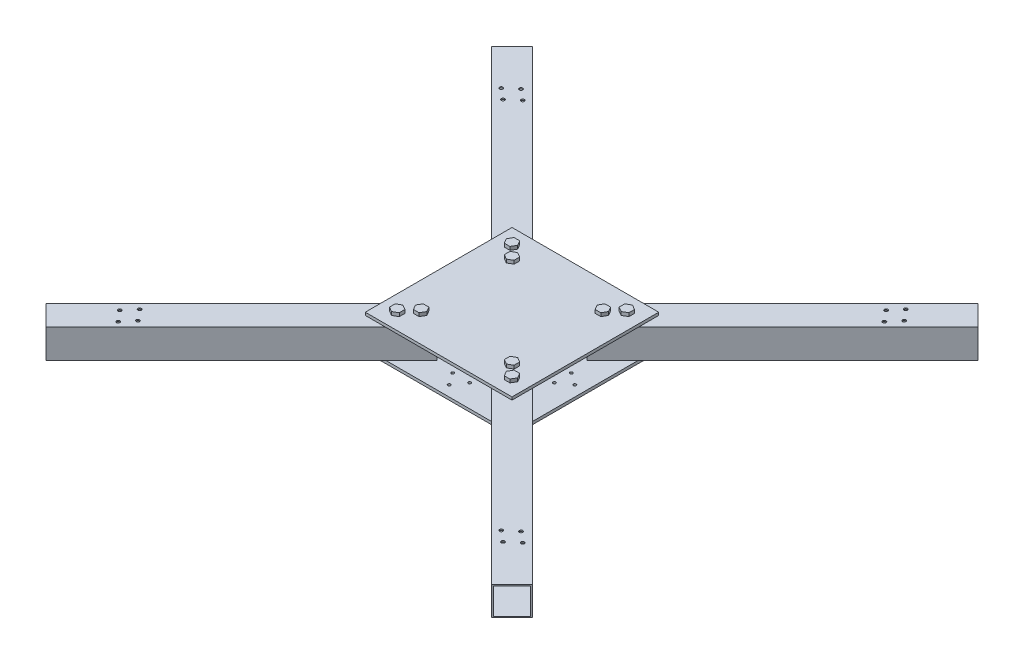
from build123d import *

# Parameters (mm, degrees)
SKETCH1_W             = 130
SKETCH1_H             = 130
BOSS_EXTRUDE1_DEPTH   = 2.5
BOSS_EXTRUDE2_START   = -45
SKETCH5_W             = 25.4
SKETCH5_H             = 25.4
SKETCH5_W_2           = 23.4
SKETCH5_H_2           = 23.4
BOSS_EXTRUDE2_DEPTH   = 245
CIRPATTERN1_COUNT     = 4
SKETCH8_W             = 130
SKETCH8_H             = 130
BOSS_EXTRUDE3_DEPTH   = 2.5
CUT_EXTRUDE1_DEPTH    = 307.137010525
CIRPATTERN2_COUNT     = 4
SKETCH11_R            = 2.5
BOSS_EXTRUDE4_DEPTH   = 38.1
BOSS_EXTRUDE4_2_DEPTH = 38.1
BOSS_EXTRUDE5_DEPTH   = 3
BOSS_EXTRUDE6_DEPTH   = 3
BOSS_EXTRUDE7_DEPTH   = 3
BOSS_EXTRUDE7_2_DEPTH = 3
CIRPATTERN5_COUNT     = 4
SKETCH16_R            = 1.5
CUT_EXTRUDE3_DEPTH    = 1
CIRPATTERN7_COUNT     = 4
SKETCH17_R            = 1.25
CUT_EXTRUDE4_DEPTH    = 2.5
CIRPATTERN8_COUNT     = 4


with BuildPart() as part:
    # Sketch1 → Boss-Extrude1 (new body)
    with BuildSketch(Plane(origin=(0, 0, 0), x_dir=(1, 0, 0), z_dir=(0, 1, 0))):
        Rectangle(SKETCH1_W, SKETCH1_H)
    extrude(amount=BOSS_EXTRUDE1_DEPTH)

    # Sketch5 → Boss-Extrude2 (add)
    with BuildSketch(Plane(origin=(65, 0, -65), x_dir=(-0.7071067811865475, 0, -0.7071067811865477), z_dir=(0.7071067811865477, 0, -0.7071067811865475)).offset(BOSS_EXTRUDE2_START)):
        with Locations((0, 15.2)):
            Rectangle(SKETCH5_W, SKETCH5_H)
        with Locations((0, 15.2)):
            Rectangle(SKETCH5_W_2, SKETCH5_H_2, mode=Mode.SUBTRACT)
    boss_extrude2 = extrude(amount=BOSS_EXTRUDE2_DEPTH)

    # CirPattern1: Boss-Extrude2 ×4 about axis
    cirpattern1_axis = Axis((0, 0, 0), (0, 1, 0))
    for i in range(1, CIRPATTERN1_COUNT):
        add(boss_extrude2.rotate(cirpattern1_axis, i * 360 / CIRPATTERN1_COUNT))

    # Sketch8 → Boss-Extrude3 (add)
    with BuildSketch(Plane(origin=(0, 27.9, 0), x_dir=(1, 0, 0), z_dir=(0, 1, 0))):
        Rectangle(SKETCH8_W, SKETCH8_H)
    extrude(amount=BOSS_EXTRUDE3_DEPTH)

    # Sketch9 → Cut-Extrude1 (cut, through all)
    with BuildSketch(Plane(origin=(0, 30.4, 0), x_dir=(1, 0, 0), z_dir=(0, 1, 0))):
        with BuildLine():
            ThreePointArc((42.019029611, 42.019029611), (38.483495706, 42.019029611), (38.483495706, 38.483495706))
            Line((38.483495706, 38.483495706), (42.019029611, 42.019029611))
        make_face()
        with BuildLine():
            Line((42.019029611, 42.019029611), (38.483495706, 38.483495706))
            ThreePointArc((38.483495706, 38.483495706), (41.207971239, 37.941563827), (42.751262658, 40.251262658))
            ThreePointArc((42.751262658, 40.251262658), (42.56096149, 41.207971239), (42.019029611, 42.019029611))
        make_face()
        with BuildLine():
            ThreePointArc((52.625631329, 52.625631329), (49.090097423, 52.625631329), (49.090097423, 49.090097423))
            Line((49.090097423, 49.090097423), (52.625631329, 52.625631329))
        make_face()
        with BuildLine():
            Line((52.625631329, 52.625631329), (49.090097423, 49.090097423))
            ThreePointArc((49.090097423, 49.090097423), (51.814572957, 48.548165545), (53.357864376, 50.857864376))
            ThreePointArc((53.357864376, 50.857864376), (53.167563208, 51.814572957), (52.625631329, 52.625631329))
        make_face()
    cut_extrude1 = extrude(amount=-CUT_EXTRUDE1_DEPTH, mode=Mode.SUBTRACT)

    # CirPattern2: Cut-Extrude1 ×4 about axis
    cirpattern2_axis = Axis((0, 0, 0), (0, 1, 0))
    for i in range(1, CIRPATTERN2_COUNT):
        add(cut_extrude1.rotate(cirpattern2_axis, i * 360 / CIRPATTERN2_COUNT), mode=Mode.SUBTRACT)

    # Sketch16 → Cut-Extrude3 (cut)
    with BuildSketch(Plane(origin=(0, 27.9, 0), x_dir=(1, 0, 0), z_dir=(0, 1, 0))):
        with Locations(Location((169.705627485, 160.205627485, 0), (0, 0, 270))):
            Circle(SKETCH16_R)
        with Locations(Location((169.705627485, 179.205627485, 0), (0, 0, 270))):
            Circle(SKETCH16_R)
        with Locations(Location((161.705627485, 169.705627485, 0), (0, 0, 270))):
            Circle(SKETCH16_R)
        with Locations(Location((177.705627485, 169.705627485, 0), (0, 0, 270))):
            Circle(SKETCH16_R)
    cut_extrude3 = extrude(amount=-CUT_EXTRUDE3_DEPTH, mode=Mode.SUBTRACT)

    # CirPattern7: Cut-Extrude3 ×4 about axis
    cirpattern7_axis = Axis((0, 0, 0), (0, 1, 0))
    for i in range(1, CIRPATTERN7_COUNT):
        add(cut_extrude3.rotate(cirpattern7_axis, i * 360 / CIRPATTERN7_COUNT), mode=Mode.SUBTRACT)

    # Sketch17 → Cut-Extrude4 (cut)
    with BuildSketch(Plane.XZ):
        with Locations(Location((0, -55.61, 0), (0, 0, 270))):
            Circle(SKETCH17_R)
        with Locations(Location((-7.5, -45, 0), (0, 0, 270))):
            Circle(SKETCH17_R)
        with Locations(Location((7.5, -45, 0), (0, 0, 270))):
            Circle(SKETCH17_R)
    cut_extrude4 = extrude(amount=-CUT_EXTRUDE4_DEPTH, mode=Mode.SUBTRACT)

    # CirPattern8: Cut-Extrude4 ×4 about axis
    cirpattern8_axis = Axis((0, 0, 0), (0, 1, 0))
    for i in range(1, CIRPATTERN8_COUNT):
        add(cut_extrude4.rotate(cirpattern8_axis, i * 360 / CIRPATTERN8_COUNT), mode=Mode.SUBTRACT)


with BuildPart() as body_2:
    # Sketch11 → Boss-Extrude4 (new body)
    with BuildSketch(Plane(origin=(0, 30.4, 0), x_dir=(1, 0, 0), z_dir=(0, 1, 0))):
        with Locations(Location((50.857864376, 50.857864376, 0), (0, 0, 270))):
            Circle(SKETCH11_R)
    extrude(amount=-BOSS_EXTRUDE4_DEPTH)


with BuildPart() as body_3:
    # Sketch11 → Boss-Extrude4 2 (new body)
    with BuildSketch(Plane(origin=(0, 30.4, 0), x_dir=(1, 0, 0), z_dir=(0, 1, 0))):
        with Locations(Location((40.251262658, 40.251262658, 0), (0, 0, 270))):
            Circle(SKETCH11_R)
    extrude(amount=-BOSS_EXTRUDE4_2_DEPTH)


with BuildPart() as body_4:
    # Sketch12 → Boss-Extrude5 (new body)
    with BuildSketch(Plane(origin=(0, 30.4, 0), x_dir=(1, 0, 0), z_dir=(0, 1, 0))):
        Polygon((50.857864376, 45.857864376), (55.187991395, 48.357864376), (55.187991395, 53.357864376), (50.857864376, 55.857864376), (46.527737357, 53.357864376), (46.527737357, 48.357864376), align=None)
    extrude(amount=BOSS_EXTRUDE5_DEPTH)


with BuildPart() as body_5:
    # Sketch13 → Boss-Extrude6 (new body)
    with BuildSketch(Plane(origin=(0, 30.4, 0), x_dir=(1, 0, 0), z_dir=(0, 1, 0))):
        Polygon((37.751262658, 35.92113564), (42.751262658, 35.92113564), (45.251262658, 40.251262658), (42.751262658, 44.581389677), (37.751262658, 44.581389677), (35.251262658, 40.251262658), align=None)
    extrude(amount=BOSS_EXTRUDE6_DEPTH)


with BuildPart() as body_6:
    # Sketch14 → Boss-Extrude7 (new body)
    with BuildSketch(Plane.XZ):
        Polygon((45.084361684, -50.857864376), (47.97111303, -55.857864376), (53.744615722, -55.857864376), (56.631367068, -50.857864376), (53.744615722, -45.857864376), (47.97111303, -45.857864376), align=None)
    extrude(amount=BOSS_EXTRUDE7_DEPTH)


with BuildPart() as body_7:
    # Sketch14 → Boss-Extrude7 2 (new body)
    with BuildSketch(Plane.XZ):
        Polygon((35.92113564, -42.751262658), (40.251262658, -45.251262658), (44.581389677, -42.751262658), (44.581389677, -37.751262658), (40.251262658, -35.251262658), (35.92113564, -37.751262658), align=None)
    extrude(amount=BOSS_EXTRUDE7_2_DEPTH)


with BuildPart() as body_2_1:
    add(body_2.part)

    # Intersect1: read off the stored shape, not the designer's step
    # Intersect1: union body 4, body 6
    add(body_4.part)
    add(body_6.part)


with BuildPart() as body_3_1:
    add(body_3.part)

    # Intersect2: read off the stored shape, not the designer's step
    # Intersect2: union body 7, body 5
    add(body_7.part)
    add(body_5.part)


with BuildPart() as cirpattern5_1:
    # CirPattern5: pattern copy
    add(body_3_1.part.rotate(Axis((0, 0, 0), (0, 1, 0)), 1 * 360 / CIRPATTERN5_COUNT))


with BuildPart() as cirpattern5_2:
    # CirPattern5: pattern copy
    add(body_3_1.part.rotate(Axis((0, 0, 0), (0, 1, 0)), 2 * 360 / CIRPATTERN5_COUNT))


with BuildPart() as cirpattern5_3:
    # CirPattern5: pattern copy
    add(body_3_1.part.rotate(Axis((0, 0, 0), (0, 1, 0)), 3 * 360 / CIRPATTERN5_COUNT))


with BuildPart() as cirpattern5_4:
    # CirPattern5: pattern copy
    add(body_2_1.part.rotate(Axis((0, 0, 0), (0, 1, 0)), 1 * 360 / CIRPATTERN5_COUNT))


with BuildPart() as cirpattern5_5:
    # CirPattern5: pattern copy
    add(body_2_1.part.rotate(Axis((0, 0, 0), (0, 1, 0)), 2 * 360 / CIRPATTERN5_COUNT))


with BuildPart() as cirpattern5_6:
    # CirPattern5: pattern copy
    add(body_2_1.part.rotate(Axis((0, 0, 0), (0, 1, 0)), 3 * 360 / CIRPATTERN5_COUNT))


solid = Compound([part.part, body_2_1.part, body_3_1.part, cirpattern5_1.part, cirpattern5_2.part, cirpattern5_3.part, cirpattern5_4.part, cirpattern5_5.part, cirpattern5_6.part])
